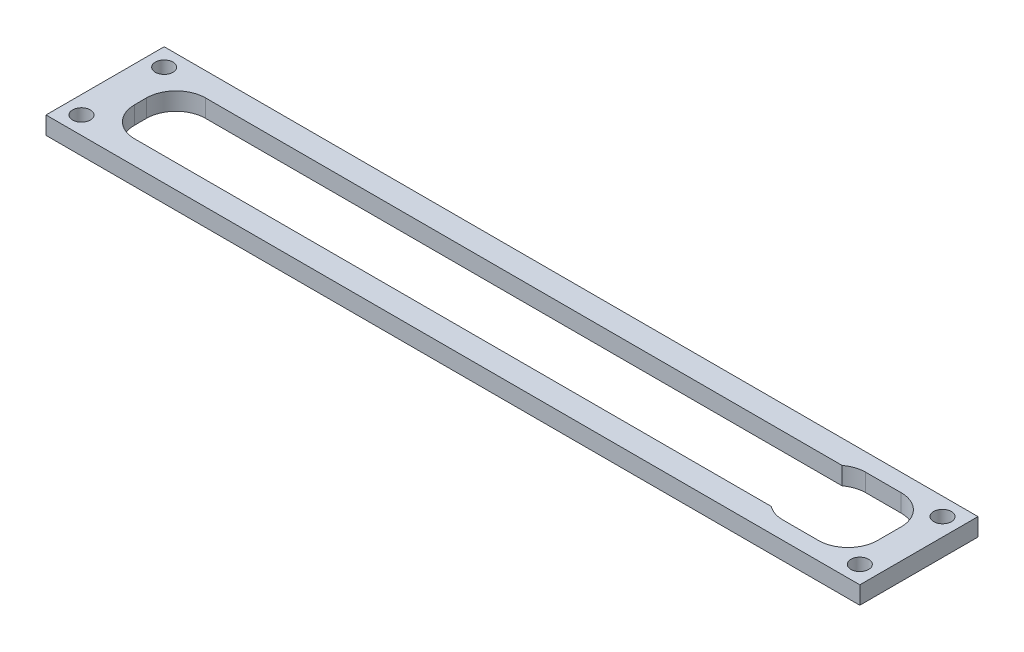
from build123d import *

# Parameters (mm, degrees)
SKETCH1_W           = 137.727780531
SKETCH1_H           = 20
SKETCH1_R           = 1.5
SKETCH1_W_2         = 125.727780531
SKETCH1_H_2         = 12
BOSS_EXTRUDE1_DEPTH = 3
CUT_EXTRUDE1_DEPTH  = 140.204674958
FILLET1_R           = 5


with BuildPart() as part:
    # Sketch1 → Boss-Extrude1 (new body)
    with BuildSketch(Plane(origin=(0, 0, 0), x_dir=(1, 0, 0), z_dir=(0, 1, 0))):
        with Locations((68.863890266, 10)):
            Rectangle(SKETCH1_W, SKETCH1_H)
        with Locations(Location((3, 17, 0), (0, 0, 270))):
            Circle(SKETCH1_R, mode=Mode.SUBTRACT)
        with Locations(Location((3, 3, 0), (0, 0, 90))):
            Circle(SKETCH1_R, mode=Mode.SUBTRACT)
        with Locations(Location((134.727780531, 3, 0), (0, 0, 270))):
            Circle(SKETCH1_R, mode=Mode.SUBTRACT)
        with Locations(Location((134.727780531, 17, 0), (0, 0, 90))):
            Circle(SKETCH1_R, mode=Mode.SUBTRACT)
        with Locations((68.863890266, 10)):
            Rectangle(SKETCH1_W_2, SKETCH1_H_2, mode=Mode.SUBTRACT)
    extrude(amount=BOSS_EXTRUDE1_DEPTH)

    # Sketch2 → Cut-Extrude1 (cut, through all)
    with BuildSketch(Plane(origin=(0, 3, 0), x_dir=(1, 0, 0), z_dir=(0, 1, 0))):
        Polygon((118.727780531, 17), (118.727780531, 16), (131.727780531, 16), (131.727780531, 4), (118.727780531, 4), (118.727780531, 3), (132.727780531, 3), (132.727780531, 17), align=None)
    extrude(amount=-CUT_EXTRUDE1_DEPTH, mode=Mode.SUBTRACT)

    # Fillet1
    # the kernel refuses this fillet: 5 mm, written as the material it adds along each edge
    with BuildSketch(Plane(origin=(132.727780531, 3, -17), x_dir=(0, 0, 1), z_dir=(0, -1, 0)), Plane(origin=(132.727780531, 3, -3), x_dir=(-1, 0, 0), z_dir=(0, -1, 0)), Plane(origin=(6, 0, -16), x_dir=(0, 0, 1), z_dir=(0, 1, 0))) as fillet1_piece_1:
        with BuildLine():
            CenterArc((FILLET1_R, FILLET1_R), FILLET1_R, 180, 90)
            Line((0, FILLET1_R), (-FILLET1_R * 0.02, FILLET1_R))
            Line((-FILLET1_R * 0.02, FILLET1_R), (-FILLET1_R * 0.02, -FILLET1_R * 0.02))
            Line((-FILLET1_R * 0.02, -FILLET1_R * 0.02), (FILLET1_R, -FILLET1_R * 0.02))
            Line((FILLET1_R, -FILLET1_R * 0.02), (FILLET1_R, 0))
        make_face()
    extrude(amount=3)
    with BuildSketch(Plane(origin=(118.727780531, 3, -17), x_dir=(1, 0, 0), z_dir=(0, -1, 0))) as fillet1_piece_2:
        with BuildLine():
            CenterArc((3, 5), FILLET1_R, 233.130102354, 36.869897646)
            Line((0, 1), (-0.06, 0.92))
            ThreePointArc((-0.06, 0.92), (-0.1, 0.5), (-0.1, 0))
            Line((-0.1, 0), (0, -0.1))
            Line((0, -0.1), (3, -0.1))
            Line((3, -0.1), (3, 0))
        make_face()
    extrude(amount=3)
    with BuildSketch(Plane(origin=(118.727780531, 3, -3), x_dir=(0, 0, -1), z_dir=(0, -1, 0))) as fillet1_piece_3:
        with BuildLine():
            CenterArc((5, 3), FILLET1_R, 180, 36.869897646)
            Line((0, 3), (-0.1, 3))
            Line((-0.1, 3), (-0.1, 0))
            Line((-0.1, 0), (0, -0.1))
            ThreePointArc((0, -0.1), (0.5, -0.1), (0.92, -0.06))
            Line((0.92, -0.06), (1, 0))
        make_face()
    extrude(amount=3)
    with BuildSketch(Plane(origin=(6, 0, -4), x_dir=(0, 0, -1), z_dir=(0, 1, 0))) as fillet1_piece_4:
        with BuildLine():
            CenterArc((FILLET1_R, -FILLET1_R), FILLET1_R, 90, 90)
            Line((0, -FILLET1_R), (-FILLET1_R * 0.02, -FILLET1_R))
            Line((-FILLET1_R * 0.02, -FILLET1_R), (-FILLET1_R * 0.02, FILLET1_R * 0.02))
            Line((-FILLET1_R * 0.02, FILLET1_R * 0.02), (FILLET1_R, FILLET1_R * 0.02))
            Line((FILLET1_R, FILLET1_R * 0.02), (FILLET1_R, 0))
        make_face()
    extrude(amount=3)


solid = part.part
